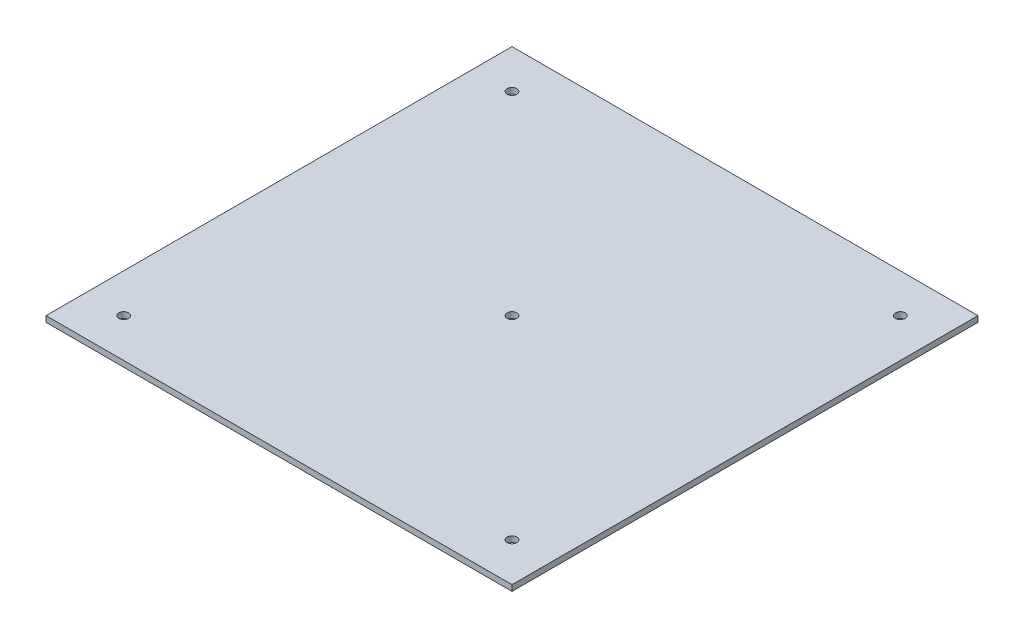
from build123d import *

# Parameters (mm, degrees)
SKETCH_1_W      = 240
SKETCH_1_H      = 240
SKETCH_1_R      = 2.5
EXTRUDE_1_DEPTH = 3


with BuildPart() as part:
    # 草图1 → 凸台-拉伸1 (new body)
    with BuildSketch(Plane(origin=(0, 0, 0), x_dir=(1, 0, 0), z_dir=(0, 1, 0))):
        with Locations((120, 120)):
            Rectangle(SKETCH_1_W, SKETCH_1_H)
        with Locations((120, 120)):
            Circle(SKETCH_1_R, mode=Mode.SUBTRACT)
        with Locations((20, 220)):
            Circle(SKETCH_1_R, mode=Mode.SUBTRACT)
        with Locations((220, 220)):
            Circle(SKETCH_1_R, mode=Mode.SUBTRACT)
        with Locations((220, 20)):
            Circle(SKETCH_1_R, mode=Mode.SUBTRACT)
        with Locations((20, 20)):
            Circle(SKETCH_1_R, mode=Mode.SUBTRACT)
    extrude(amount=EXTRUDE_1_DEPTH)


solid = part.part
